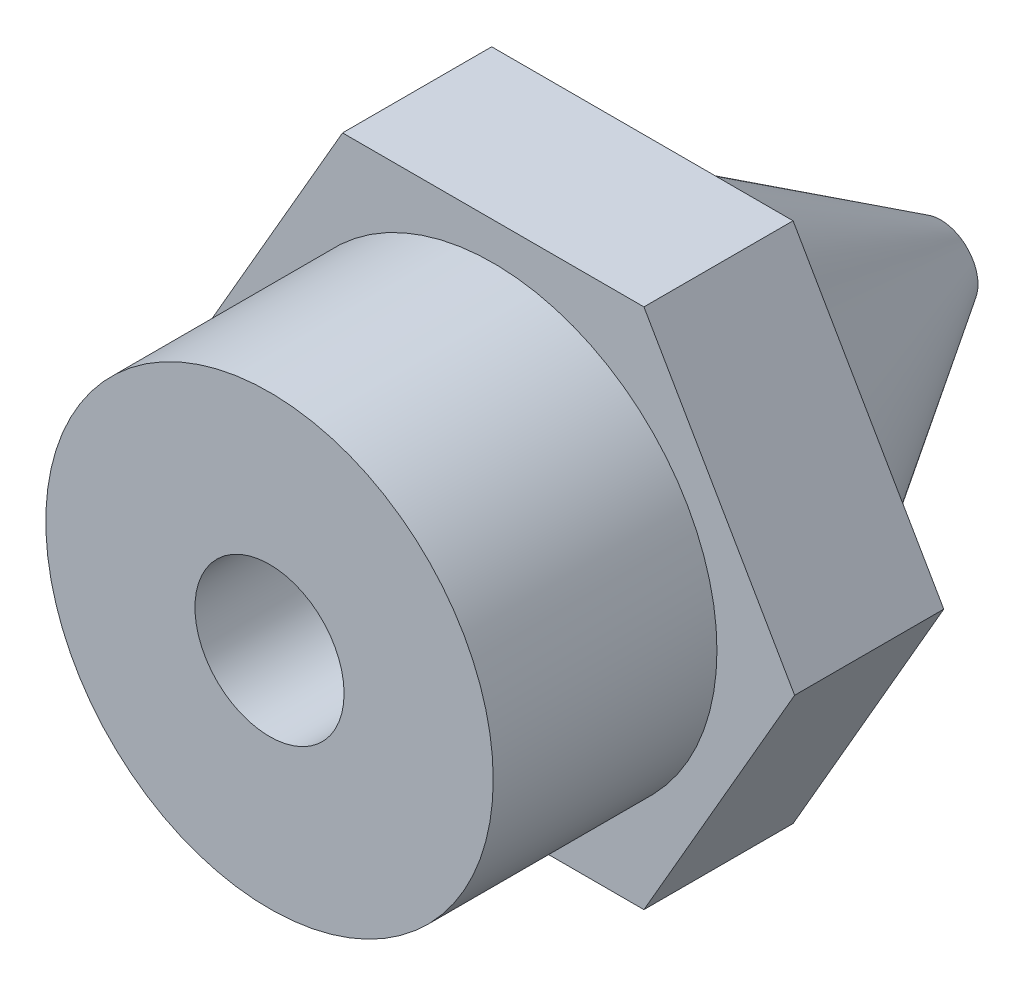
from build123d import *

# Parameters (mm, degrees)
BOSS_EXTRU_1_DEPTH      = 9
ESQUISSE2_W             = 19.623971562
ESQUISSE2_H             = 15.534154535
ESQUISSE2_R             = 3
ENL_V_MAT_EXTRU_1_DEPTH = 3
ENL_V_START             = -4
ESQUISSE3_W             = 11.267201257
ESQUISSE3_H             = 13.961169169
ESQUISSE3_R             = 3
ENL_V_MAT_EXTRU_2_DEPTH = 4
CHANFREIN1_SIZE         = 4
CHANFREIN1_SIZE_2       = 2.499477408


with BuildPart() as part:
    # Esquisse1 → Boss.-Extru.1 (new body)
    with BuildSketch(Plane.XY):
        Polygon((4.041451884, 0), (2.020725942, 3.5), (-2.020725942, 3.5), (-4.041451884, 0), (-2.020725942, -3.5), (2.020725942, -3.5), align=None)
    extrude(amount=BOSS_EXTRU_1_DEPTH)

    # Esquisse2 → Enlèv. mat.-Extru.1 (cut)
    with BuildSketch(Plane.XY.offset(9)):
        with Locations((0.327116653, -1.544441398)):
            Rectangle(ESQUISSE2_W, ESQUISSE2_H)
        Circle(ESQUISSE2_R, mode=Mode.SUBTRACT)
    extrude(amount=-ENL_V_MAT_EXTRU_1_DEPTH, mode=Mode.SUBTRACT)

    # Esquisse3 → Enlèv. mat.-Extru.2 (cut)
    with BuildSketch(Plane(origin=(0, 0, 0), x_dir=(-1, 0, 0), z_dir=(0, 0, -1)).offset(ENL_V_START)):
        with Locations((0.009770186, 0.039262349)):
            Rectangle(ESQUISSE3_W, ESQUISSE3_H)
        with Locations(Location((0, 0, 0), (0, 0, 180))):
            Circle(ESQUISSE3_R, mode=Mode.SUBTRACT)
    extrude(amount=ENL_V_MAT_EXTRU_2_DEPTH, mode=Mode.SUBTRACT)

    # Chanfrein1
    # the kernel refuses this chamfer: 4, 2.499477408 mm, written as the material it takes off along each edge
    with BuildSketch(Plane(origin=(0, 0, 0), x_dir=(1, 0, 0), z_dir=(0, 1, 0))) as chanfrein1_piece_1_section:
        Polygon((3, -CHANFREIN1_SIZE), (3 - CHANFREIN1_SIZE_2, 0), (3, 0), align=None)
    chanfrein1_piece_1 = revolve(axis=Axis((0, 0, 0), (0, 0, -1)), mode=Mode.PRIVATE)
    chanfrein1_piece_1 = split(chanfrein1_piece_1, bisect_by=Plane(origin=(-1.744026904, 0, 4), z_dir=(0, 0, -1)), keep=Keep.TOP, mode=Mode.PRIVATE)
    add(chanfrein1_piece_1, mode=Mode.SUBTRACT)

    # Esquisse4 → Enlèvement de matière-Révolution1 (revolve, cut)
    with BuildSketch(Plane(origin=(0, 0, 0), x_dir=(1, 0, 0), z_dir=(0, 1, 0))):
        Polygon((0, -9), (1, -9), (1, -1.642518405), (0.2, -0.5), (0.2, 0), (0, 0), align=None)
    revolve(axis=Axis((0, 0, 9.404603351), (0, 0, -1)), mode=Mode.SUBTRACT)


solid = part.part
